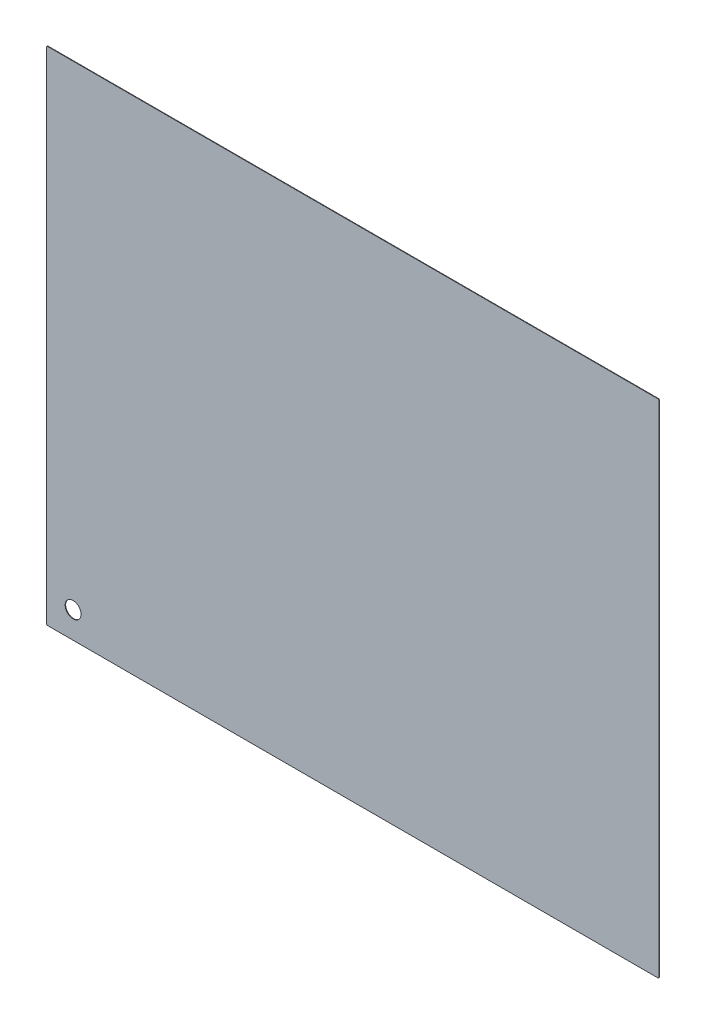
from build123d import *

# Parameters (mm, degrees)
SKETCH1_R          = 15
BASE_FLANGE1_DEPTH = 1


# Sheet-metal steps are written as plain solids
with BuildPart() as part:
    # Sketch1 → Base-Flange1 (new body)
    with BuildSketch(Plane.XY):
        with BuildLine():
            Line((2, 0), (1154, 0))
            ThreePointArc((1154, 0), (1155.414213562, 0.585786438), (1156, 2))
            Line((1156, 2), (1156, 945))
            ThreePointArc((1156, 945), (1155.414213562, 946.414213562), (1154, 947))
            Line((1154, 947), (2, 947))
            ThreePointArc((2, 947), (0.585786438, 946.414213562), (0, 945))
            Line((0, 945), (0, 2))
            ThreePointArc((0, 2), (0.585786438, 0.585786438), (2, 0))
        make_face()
        with Locations((50, 50)):
            Circle(SKETCH1_R, mode=Mode.SUBTRACT)
    extrude(amount=-BASE_FLANGE1_DEPTH)


solid = part.part
